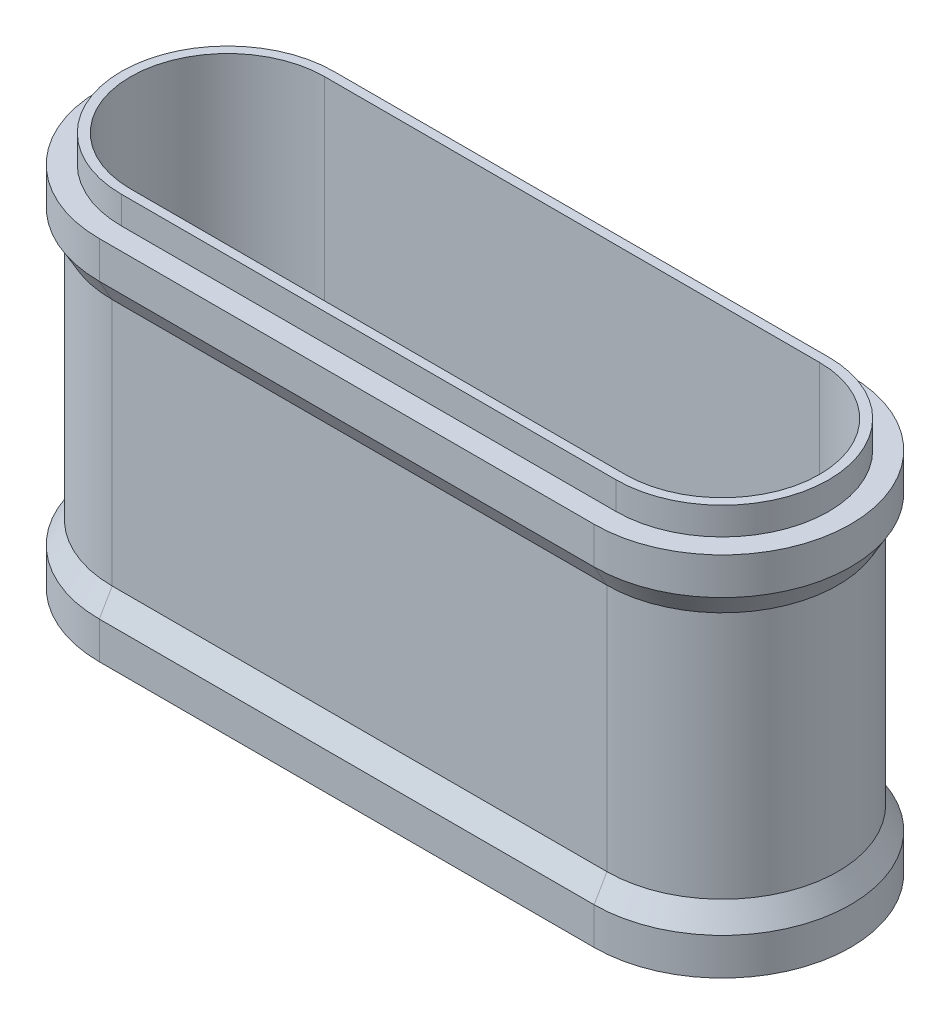
from build123d import *

# Parameters (mm, degrees)
BOSS_EXTRUDE1_DEPTH      = 10
BOSS_EXTRUDE1_DEPTH_BACK = 10
BOSS_EXTRUDE2_START      = -1.5
BOSS_EXTRUDE2_DEPTH      = 1.5
BOSS_EXTRUDE3_DEPTH      = 1.5
CHAMFER1_SIZE            = 1
CHAMFER1_SIZE_2          = 1.732050808


with BuildPart() as part:
    # Sketch1 → Boss-Extrude1 (new, two sides: drawn at the far end of the back side and taken through both)
    with BuildSketch(Plane(origin=(0, 0, 0), x_dir=(1, 0, 0), z_dir=(0, 1, 0)).offset(-BOSS_EXTRUDE1_DEPTH_BACK)):
        with BuildLine():
            Line((-13.5, 6.3), (13.5, 6.3))
            ThreePointArc((13.5, 6.3), (19.8, 0), (13.5, -6.3))
            Line((13.5, -6.3), (-13.5, -6.3))
            ThreePointArc((-13.5, -6.3), (-19.8, 0), (-13.5, 6.3))
        make_face()
        with BuildLine():
            Line((-13.5, 5.3), (13.5, 5.3))
            ThreePointArc((13.5, 5.3), (18.8, 0), (13.5, -5.3))
            Line((13.5, -5.3), (-13.5, -5.3))
            ThreePointArc((-13.5, -5.3), (-18.8, 0), (-13.5, 5.3))
        make_face(mode=Mode.SUBTRACT)
    extrude(amount=BOSS_EXTRUDE1_DEPTH + BOSS_EXTRUDE1_DEPTH_BACK)

    # Sketch2 → Boss-Extrude2 (add)
    with BuildSketch(Plane(origin=(0, 10, 0), x_dir=(1, 0, 0), z_dir=(0, 1, 0)).offset(BOSS_EXTRUDE2_START)):
        with BuildLine():
            Line((13.5, -7), (-13.5, -7))
            ThreePointArc((-13.5, -7), (-20.5, 0), (-13.5, 7))
            Line((-13.5, 7), (13.5, 7))
            ThreePointArc((13.5, 7), (20.5, 0), (13.5, -7))
        make_face()
        with BuildLine():
            Line((-13.5, -5.3), (13.5, -5.3))
            ThreePointArc((13.5, -5.3), (18.8, 0), (13.5, 5.3))
            Line((13.5, 5.3), (-13.5, 5.3))
            ThreePointArc((-13.5, 5.3), (-18.8, 0), (-13.5, -5.3))
        make_face(mode=Mode.SUBTRACT)
    boss_extrude2 = extrude(amount=BOSS_EXTRUDE2_DEPTH)

    # Mirror1: Boss-Extrude2 across plane
    add(boss_extrude2.mirror(Plane.ZX))

    # Sketch3 → Boss-Extrude3 (add)
    with BuildSketch(Plane(origin=(0, 10, 0), x_dir=(1, 0, 0), z_dir=(0, 1, 0))):
        with BuildLine():
            Line((-13.5, -5.8), (13.5, -5.8))
            ThreePointArc((13.5, -5.8), (19.3, 0), (13.5, 5.8))
            Line((13.5, 5.8), (-13.5, 5.8))
            ThreePointArc((-13.5, 5.8), (-19.3, 0), (-13.5, -5.8))
        make_face()
        with BuildLine():
            Line((-13.5, -5.3), (13.5, -5.3))
            ThreePointArc((13.5, -5.3), (18.8, 0), (13.5, 5.3))
            Line((13.5, 5.3), (-13.5, 5.3))
            ThreePointArc((-13.5, 5.3), (-18.8, 0), (-13.5, -5.3))
        make_face(mode=Mode.SUBTRACT)
    extrude(amount=BOSS_EXTRUDE3_DEPTH)

    # Chamfer1
    # the kernel refuses this chamfer: 1.732050808, 1 mm, written as the material it adds along each edge
    with BuildSketch(Plane(origin=(13.5, -8.5, 0), x_dir=(0, 0, -1), z_dir=(-1, 0, 0))) as chamfer1_piece_1_section:
        Polygon((6.3 + CHAMFER1_SIZE, 0), (6.3, -CHAMFER1_SIZE_2), (6.3, 0), align=None)
    chamfer1_piece_1 = revolve(axis=Axis((13.5, -8.5, 0), (0, -1, 0)), revolution_arc=180, mode=Mode.PRIVATE)
    chamfer1_piece_1 = chamfer1_piece_1 & Plane(origin=(13.5, -7.628425911, 0), x_dir=(0, 0, -1), z_dir=(0, 1, 0)) * Cylinder(7, 30, mode=Mode.PRIVATE)
    add(chamfer1_piece_1)
    with BuildSketch(Plane(origin=(13.5, -8.5, -6.3), x_dir=(0, -0.05789386240267147, -0.9983227437537926), z_dir=(-1, 0, 0))) as chamfer1_piece_2_section:
        Polygon((CHAMFER1_SIZE * 0.998322743754, -CHAMFER1_SIZE * 0.0578938624027), (-CHAMFER1_SIZE_2 * 0.0578938623883, -CHAMFER1_SIZE_2 * 0.998322743505), (0, 0), align=None)
    chamfer1_piece_2 = extrude(amount=27, mode=Mode.PRIVATE)
    chamfer1_piece_2 = split(chamfer1_piece_2, bisect_by=Plane(origin=(1.75e-07, -7.878612067, -7), z_dir=(0, 0, 1)), keep=Keep.TOP, mode=Mode.PRIVATE)
    add(chamfer1_piece_2)
    with BuildSketch(Plane(origin=(-13.5, -8.5, 6.3), x_dir=(0, -0.05789386240267147, 0.9983227437537926), z_dir=(1, 0, 0))) as chamfer1_piece_3_section:
        Polygon((CHAMFER1_SIZE * 0.998322743754, -CHAMFER1_SIZE * 0.0578938624027), (-CHAMFER1_SIZE_2 * 0.0578938623883, -CHAMFER1_SIZE_2 * 0.998322743505), (0, 0), align=None)
    chamfer1_piece_3 = extrude(amount=27, mode=Mode.PRIVATE)
    chamfer1_piece_3 = split(chamfer1_piece_3, bisect_by=Plane(origin=(-1.75e-07, -7.878612067, 7), z_dir=(0, 0, -1)), keep=Keep.TOP, mode=Mode.PRIVATE)
    add(chamfer1_piece_3)
    with BuildSketch(Plane(origin=(-13.5, -8.5, 0), x_dir=(0, 0, 1), z_dir=(1, 0, 0))) as chamfer1_piece_4_section:
        Polygon((6.3 + CHAMFER1_SIZE, 0), (6.3, -CHAMFER1_SIZE_2), (6.3, 0), align=None)
    chamfer1_piece_4 = revolve(axis=Axis((-13.5, -8.5, 0), (0, -1, 0)), revolution_arc=180, mode=Mode.PRIVATE)
    chamfer1_piece_4 = chamfer1_piece_4 & Plane(origin=(-13.5, -7.628425911, 0), x_dir=(0, 0, 1), z_dir=(0, 1, 0)) * Cylinder(7, 30, mode=Mode.PRIVATE)
    add(chamfer1_piece_4)
    with BuildSketch(Plane(origin=(13.5, 8.5, -6.3), x_dir=(0, -0.9998132206222079, 0.01932676561270069), z_dir=(-1, 0, 0))) as chamfer1_piece_5_section:
        Polygon((CHAMFER1_SIZE_2 * 0.999813220373, -CHAMFER1_SIZE_2 * 0.0193267656079), (-CHAMFER1_SIZE * 0.0193267656127, -CHAMFER1_SIZE * 0.999813220622), (0, 0), align=None)
    chamfer1_piece_5 = extrude(amount=27, mode=Mode.PRIVATE)
    chamfer1_piece_5 = split(chamfer1_piece_5, bisect_by=Plane(origin=(12.241463367, 7.814472043, -7), z_dir=(0, 0, 1)), keep=Keep.TOP, mode=Mode.PRIVATE)
    add(chamfer1_piece_5)
    with BuildSketch(Plane(origin=(13.5, 8.5, 0), x_dir=(0, 0, -1), z_dir=(-1, 0, 0))) as chamfer1_piece_6_section:
        Polygon((6.3 + CHAMFER1_SIZE, 0), (6.3, CHAMFER1_SIZE_2), (6.3, 0), align=None)
    chamfer1_piece_6 = revolve(axis=Axis((13.5, 8.5, 0), (0, -1, 0)), revolution_arc=180, mode=Mode.PRIVATE)
    chamfer1_piece_6 = chamfer1_piece_6 & Plane(origin=(13.5, 7.628425911, 0), x_dir=(0, 0, -1), z_dir=(0, -1, 0)) * Cylinder(7, 30, mode=Mode.PRIVATE)
    add(chamfer1_piece_6)
    with BuildSketch(Plane(origin=(-13.5, 8.5, 0), x_dir=(0, 0, 1), z_dir=(1, 0, 0))) as chamfer1_piece_7_section:
        Polygon((6.3 + CHAMFER1_SIZE, 0), (6.3, CHAMFER1_SIZE_2), (6.3, 0), align=None)
    chamfer1_piece_7 = revolve(axis=Axis((-13.5, 8.5, 0), (0, -1, 0)), revolution_arc=180, mode=Mode.PRIVATE)
    chamfer1_piece_7 = chamfer1_piece_7 & Plane(origin=(-13.5, 7.628425911, 0), x_dir=(0, 0, 1), z_dir=(0, -1, 0)) * Cylinder(7, 30, mode=Mode.PRIVATE)
    add(chamfer1_piece_7)
    with BuildSketch(Plane(origin=(-13.5, 8.5, 6.3), x_dir=(0, 0.05789386240267147, 0.9983227437537926), z_dir=(1, 0, 0))) as chamfer1_piece_8_section:
        Polygon((CHAMFER1_SIZE * 0.998322743754, CHAMFER1_SIZE * 0.0578938624027), (-CHAMFER1_SIZE_2 * 0.0578938623883, CHAMFER1_SIZE_2 * 0.998322743505), (0, 0), align=None)
    chamfer1_piece_8 = extrude(amount=27, mode=Mode.PRIVATE)
    chamfer1_piece_8 = split(chamfer1_piece_8, bisect_by=Plane(origin=(-1.75e-07, 7.878612067, 7), z_dir=(0, 0, -1)), keep=Keep.TOP, mode=Mode.PRIVATE)
    add(chamfer1_piece_8)


solid = part.part
